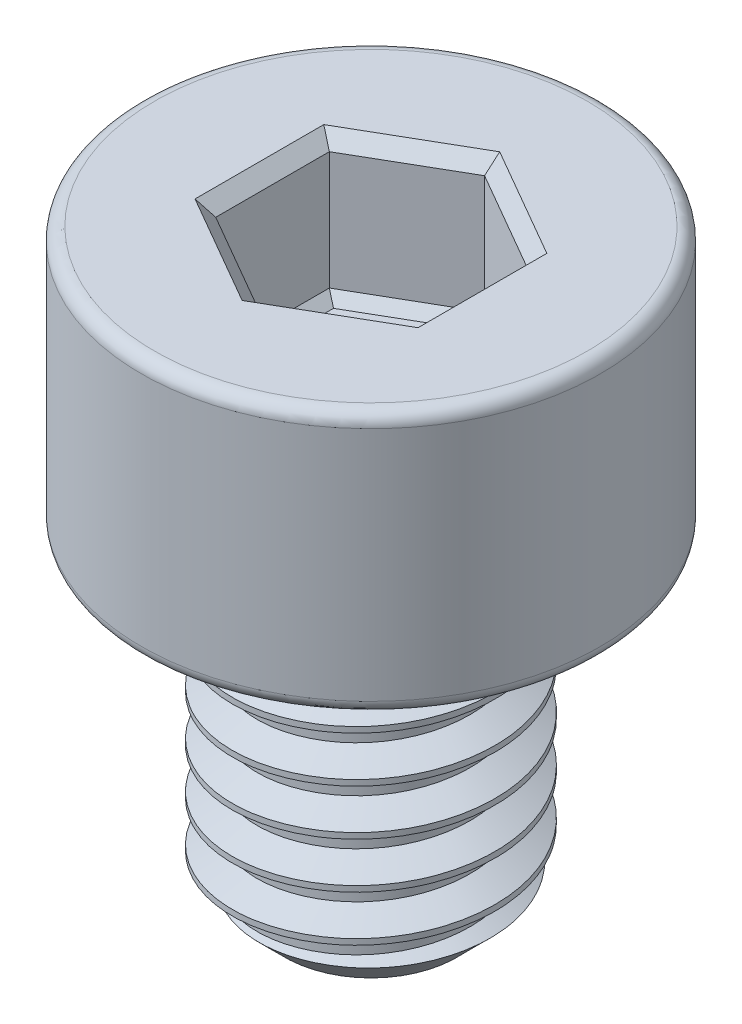
from build123d import *

# Parameters (mm, degrees)
SKETCH1_R           = 2
BOSS_EXTRUDE1_DEPTH = 5
THREAD1_PITCH       = 0.7
SKETCH4_R           = 3.5
BOSS_EXTRUDE2_DEPTH = 4
FILLET1_R           = 0.2
CUT_EXTRUDE1_DEPTH  = 2
CHAMFER1_SIZE       = 0.2
CUT_EXTRUDE2_DEPTH  = 0.15
CUT_EXTRUDE2_DRAFT  = -45


with BuildPart() as part:
    # Sketch1 → Boss-Extrude1 (new body)
    with BuildSketch(Plane(origin=(0, 0, 0), x_dir=(1, 0, 0), z_dir=(0, 1, 0))):
        with Locations(Location((0, 0, 0), (0, 0, 270))):
            Circle(SKETCH1_R)
    extrude(amount=BOSS_EXTRUDE1_DEPTH)

    # Thread1: arcs per turn and ends read off the stored shape
    # Thread1: the profile of Thread Profile1 profile screwed along a right-hand helix through 10 turns, 6 arcs to a turn; built about Z, then put on its axis
    thread1_z = Axis((0, 0, 0), (0, 0, 1))
    thread1_corners = [(2.0003, 0, -0.000173205), (2.0003, 0, 0.612673203), (1.621113887, 0, 0.393749999), (1.621113887, 0, 0.218749999)]
    with BuildLine(mode=Mode.PRIVATE) as thread1_profile:
        Line(thread1_corners[0], thread1_corners[1])
        Line(thread1_corners[1], thread1_corners[2])
        Line(thread1_corners[2], thread1_corners[3])
        Line(thread1_corners[3], thread1_corners[0])
    thread1_cap = Face(thread1_profile.wire())
    thread1_turn_angles = [0, 30, 60, 90, 120, 150, 180, 210, 240, 270, 300, 330, 360]
    thread1_turn_weights = [1, 0.8660254037844387, 1, 0.8660254037844387, 1, 0.8660254037844387, 1, 0.8660254037844387, 1, 0.8660254037844387, 1, 0.8660254037844387, 1]
    thread1_turn_rails = [Edge.make_bspline([Vector(p[0], p[1], 0).rotate(thread1_z, thread1_turn_angles[k]) / thread1_turn_weights[k] + Vector(0, 0, p[2] + THREAD1_PITCH * thread1_turn_angles[k] / 360) for k in range(13)], [0, 0, 0, 1, 1, 2, 2, 3, 3, 4, 4, 5, 5, 6, 6, 6], 2, thread1_turn_weights) for p in thread1_corners]
    thread1_turn_sides = [Face.make_surface_from_curves(thread1_turn_rails[p[0]], thread1_turn_rails[p[1]]) for p in [(0, 1), (1, 2), (2, 3), (3, 0)]]
    thread1 = Plane(origin=(0, -1, 0), x_dir=(1, 0, 0), z_dir=(0, 1, 0)) * Solid(Shell([*[p.moved(Location((0, 0, THREAD1_PITCH * i))) for i in range(10) for p in thread1_turn_sides], thread1_cap, thread1_cap.rotate(thread1_z, 3600).moved(Location((0, 0, THREAD1_PITCH * 3600 / 360)))]))
    add(thread1, mode=Mode.SUBTRACT)

    # Sketch4 → Boss-Extrude2 (add)
    with BuildSketch(Plane(origin=(0, 5, 0), x_dir=(-1, 0, 0), z_dir=(0, -1, 0))):
        with Locations(Location((0, 0, 0), (0, 0, 90))):
            Circle(SKETCH4_R)
    extrude(amount=-BOSS_EXTRUDE2_DEPTH)

    # Fillet1
    fillet1_edges = [part.edges().sort_by_distance(p)[0] for p in [
        (0, 5, 3.5),
        (0, 9, 3.5),
    ]]
    fillet(fillet1_edges, radius=FILLET1_R)

    # Sketch6 → Cut-Revolve1 (revolve, cut)
    with BuildSketch(Plane.XY, mode=Mode.PRIVATE) as cut_revolve1_sk:
        Polygon((2.01, 0), (2.01, 0.7), (1.31, 0), align=None)
    revolve(cut_revolve1_sk.sketch.rotate(Axis((0, 0, 0), (0, 1, 0)), 202.132599438), axis=Axis((0, 0, 0), (0, 1, 0)), mode=Mode.SUBTRACT)

    # Sketch7 → Cut-Extrude1 (cut)
    with BuildSketch(Plane(origin=(0, 9, 0), x_dir=(1, 0, 0), z_dir=(0, 1, 0))):
        Polygon((0, 1.732050808), (-1.5, 0.866025404), (-1.5, -0.866025404), (0, -1.732050808), (1.5, -0.866025404), (1.5, 0.866025404), align=None)
    extrude(amount=-CUT_EXTRUDE1_DEPTH, mode=Mode.SUBTRACT)

    # Chamfer1
    chamfer1_edges = [part.edges().sort_by_distance(p)[0] for p in [
        (0.75, 9, -1.299038106),
        (-0.75, 9, -1.299038106),
        (-1.5, 9, 0),
        (-0.75, 9, 1.299038106),
        (0.75, 9, 1.299038106),
        (1.5, 9, 0),
    ]]
    chamfer(chamfer1_edges, length=CHAMFER1_SIZE)


with BuildPart() as cut_extrude2_tool:
    # Sketch8 → Cut-Extrude2 (with draft: the straight prism first)
    with BuildSketch(Plane(origin=(0, 7, 0), x_dir=(1, 0, 0), z_dir=(0, 1, 0))):
        Polygon((0, 1.732050808), (-1.5, 0.866025404), (-1.5, -0.866025404), (0, -1.732050808), (1.5, -0.866025404), (1.5, 0.866025404), align=None)
    extrude(amount=-CUT_EXTRUDE2_DEPTH)
    # Cut-Extrude2: the draft: its side faces are tilted about the plane it starts from
    cut_extrude2_sides = [cut_extrude2_tool.faces().sort_by_distance(p)[0] for p in [
        (-0.75, 6.925, -1.299038106),
        (-1.5, 6.925, 0),
        (-0.75, 6.925, 1.299038106),
        (0.75, 6.925, 1.299038106),
        (1.5, 6.925, 0),
        (0.75, 6.925, -1.299038106),
    ]]
    draft(cut_extrude2_sides, Plane(origin=(0, 7, 0), x_dir=(1, 0, 0), z_dir=(0, 1, 0)), CUT_EXTRUDE2_DRAFT)


with BuildPart() as part_1:
    add(part.part)

    # Cut-Extrude2: cut by cut_extrude2_tool
    add(cut_extrude2_tool.part, mode=Mode.SUBTRACT)


solid = part_1.part
